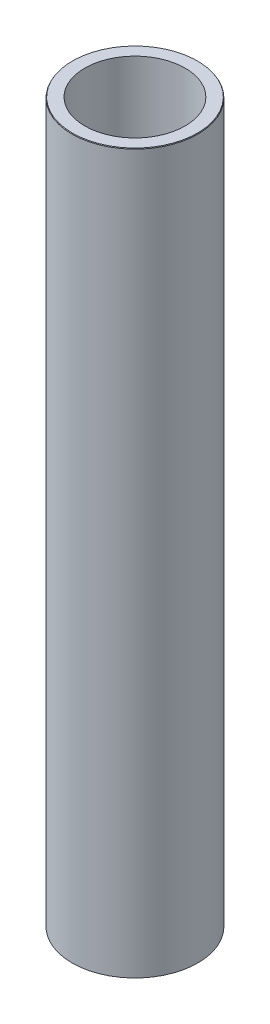
from build123d import *
from OCP.BRepFilletAPI import BRepFilletAPI_MakeChamfer

# Parameters (mm, degrees)
SKETCH1_R           = 52.5
BOSS_EXTRUDE1_DEPTH = 600
SKETCH2_R           = 41.864412991
CUT_EXTRUDE1_DEPTH  = 605.576297914
CHAMFER1_SIZE       = 0.579189613
CHAMFER1_SIZE2      = 0.334395279


with BuildPart() as part:
    # Sketch1 → Boss-Extrude1 (new body)
    with BuildSketch(Plane(origin=(0, 0, 0), x_dir=(1, 0, 0), z_dir=(0, 1, 0))):
        Circle(SKETCH1_R)
    extrude(amount=BOSS_EXTRUDE1_DEPTH)

    # Sketch2 → Cut-Extrude1 (cut, through all)
    with BuildSketch(Plane(origin=(0, 0, 0), x_dir=(1, 0, 0), z_dir=(0, 1, 0))):
        Circle(SKETCH2_R)
    extrude(amount=CUT_EXTRUDE1_DEPTH, mode=Mode.SUBTRACT)

    # Chamfer1: one chamfer whose edges measure the first distance from different faces: ONE call of the kernel's chamfer builder (chamfer() names one face for all edges)
    chamfer1_edges_1 = [part.edges().sort_by_distance(p)[0] for p in [
        (-52.5, 600, 0),
    ]]
    chamfer1_side_1 = [part.faces().sort_by_distance(p)[0] for p in [
        (-52.5, 300, 0),
    ]]
    chamfer1_edges_2 = [part.edges().sort_by_distance(p)[0] for p in [
        (-52.5, 0, 0),
    ]]
    chamfer1_side_2 = [part.faces().sort_by_distance(p)[0] for p in [
        (-51.01507576, 0, 0),
    ]]
    chamfer1 = BRepFilletAPI_MakeChamfer(part.part.solid().wrapped)
    for e in chamfer1_edges_1:
        chamfer1.Add(CHAMFER1_SIZE, CHAMFER1_SIZE2, e.wrapped, chamfer1_side_1[0].wrapped)  # the first distance lies on this face
    for e in chamfer1_edges_2:
        chamfer1.Add(CHAMFER1_SIZE, CHAMFER1_SIZE2, e.wrapped, chamfer1_side_2[0].wrapped)  # the first distance lies on this face
    add(Compound.cast(chamfer1.Shape()), mode=Mode.REPLACE)


solid = part.part
